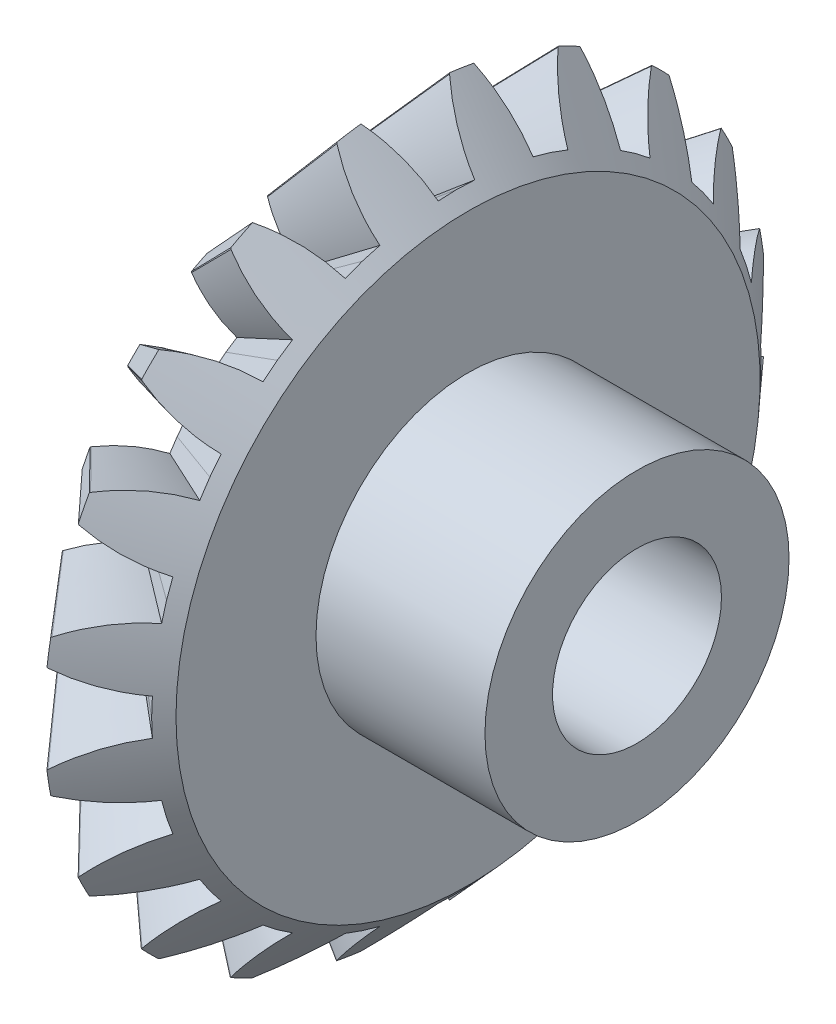
from build123d import *

# Parameters (mm, degrees)
CIRPATTERN1_COUNT   = 20
SKETCH5_R           = 12.5
CUT_EXTRUDE1_DEPTH  = 63
BOSS_EXTRUDE2_START = 25
SKETCH6_R           = 22.5
SKETCH6_R_2         = 12.5
BOSS_EXTRUDE2_DEPTH = 25


with BuildPart() as part:
    # Sketch1 → Revolve1 (revolve)
    with BuildSketch(Plane.XY):
        Polygon((46.338828747, 53.409896559), (55.639313005, 43.215640379), (55.639313005, 0), (42.112467756, 0), (40.762041713, 30.773212992), (33.232103037, 38.303151669), align=None)
    revolve(axis=Axis((42.112467756, 0, 0), (1, 0, 0)))

    # Sketch2 → Cut-Loft2 section 0
    with BuildSketch(Plane(origin=(51.882366134, 47.333627979, 0), x_dir=(0, 0, -1), z_dir=(0.7387493882257327, 0.6739802232974687, 0)), mode=Mode.PRIVATE) as cut_loft2_s0:
        with BuildLine():
            Line((-2.7, -3.108319504), (0, -3.024925738))
            Line((0, -3.024925738), (2.7, -3.108319504))
            ThreePointArc((2.7, -3.108319504), (4.036766069, 2.561153365), (6.5, 7.83963276))
            Line((6.5, 7.83963276), (8.745934708, 9.517193078))
            Line((8.745934708, 9.517193078), (-7.421588939, 9.517193078))
            Line((-7.421588939, 9.517193078), (-6.5, 7.83963276))
            ThreePointArc((-6.5, 7.83963276), (-4.036766069, 2.561153365), (-2.7, -3.108319504))
        make_face()
    cut_loft2 = loft([Vertex(0, 0, 0), cut_loft2_s0.sketch], mode=Mode.SUBTRACT)

    # CirPattern1: Cut-Loft2 ×20 about axis
    cirpattern1_axis = Axis((40.762041713, 0, 0), (-1, 0, 0))
    for i in range(1, CIRPATTERN1_COUNT):
        add(cut_loft2.rotate(cirpattern1_axis, i * 360 / CIRPATTERN1_COUNT), mode=Mode.SUBTRACT)

    # Sketch5 → Cut-Extrude1 (cut)
    with BuildSketch(Plane(origin=(55.639313005, 0, 0), x_dir=(0, 0, -1), z_dir=(1, 0, 0))):
        Circle(SKETCH5_R)
    extrude(amount=-CUT_EXTRUDE1_DEPTH, mode=Mode.SUBTRACT)

    # Sketch6 → Boss-Extrude2 (add)
    with BuildSketch(Plane(origin=(55.639313005, 0, 0), x_dir=(0, 0, -1), z_dir=(1, 0, 0)).offset(BOSS_EXTRUDE2_START)):
        Circle(SKETCH6_R)
        Circle(SKETCH6_R_2, mode=Mode.SUBTRACT)
    extrude(amount=-BOSS_EXTRUDE2_DEPTH)


solid = part.part
